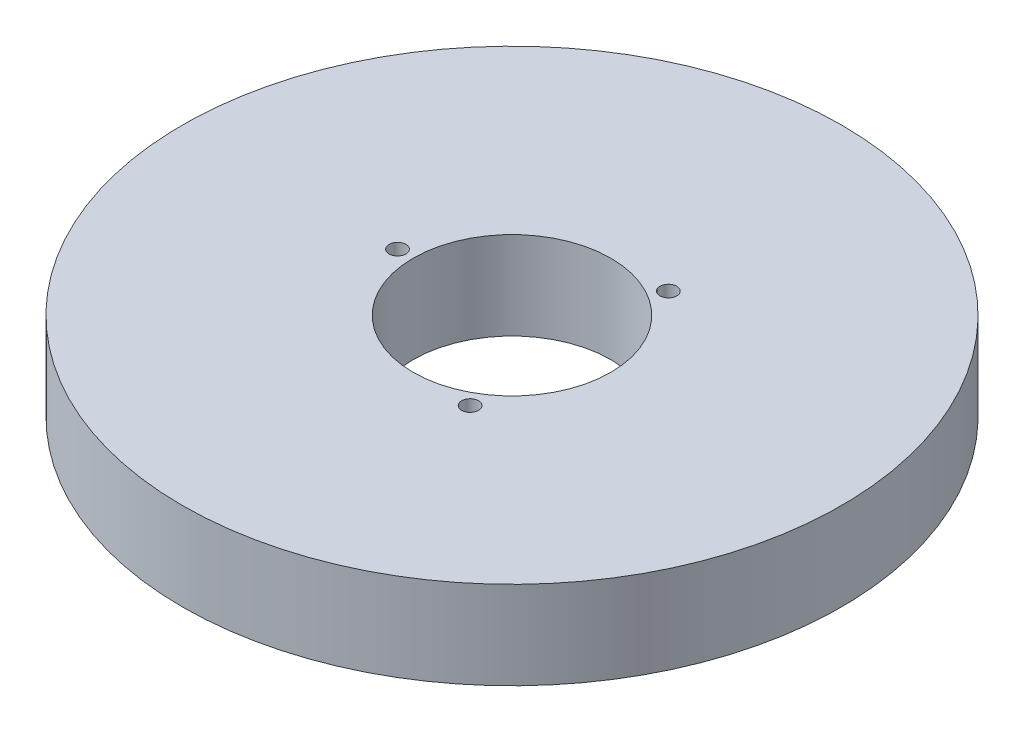
from build123d import *

# Parameters (mm, degrees)
SKETCH1_R           = 75
BOSS_EXTRUDE1_DEPTH = 20
SKETCH2_R           = 22.5
CUT_EXTRUDE1_DEPTH  = 108.935165725
SKETCH3_R           = 1.909197161
CUT_EXTRUDE2_DEPTH  = 18.190324685
CIRPATTERN1_COUNT   = 3


with BuildPart() as part:
    # Sketch1 → Boss-Extrude1 (new body)
    with BuildSketch(Plane(origin=(0, 0, 0), x_dir=(1, 0, 0), z_dir=(0, 1, 0))):
        Circle(SKETCH1_R)
    extrude(amount=BOSS_EXTRUDE1_DEPTH)

    # Sketch2 → Cut-Extrude1 (cut, through all)
    with BuildSketch(Plane(origin=(0, 0, 0), x_dir=(1, 0, 0), z_dir=(0, 1, 0))):
        Circle(SKETCH2_R)
    extrude(amount=CUT_EXTRUDE1_DEPTH, mode=Mode.SUBTRACT)

    # Sketch3 → Cut-Extrude2 (cut)
    with BuildSketch(Plane(origin=(0, 20, 0), x_dir=(1, 0, 0), z_dir=(0, 1, 0))):
        with Locations((-26.053157287, 0)):
            Circle(SKETCH3_R)
    cut_extrude2 = extrude(amount=-CUT_EXTRUDE2_DEPTH, mode=Mode.SUBTRACT)

    # CirPattern1: Cut-Extrude2 ×3 about axis
    cirpattern1_axis = Axis((0, 0, 0), (0, 1, 0))
    for i in range(1, CIRPATTERN1_COUNT):
        add(cut_extrude2.rotate(cirpattern1_axis, i * 360 / CIRPATTERN1_COUNT), mode=Mode.SUBTRACT)


solid = part.part
